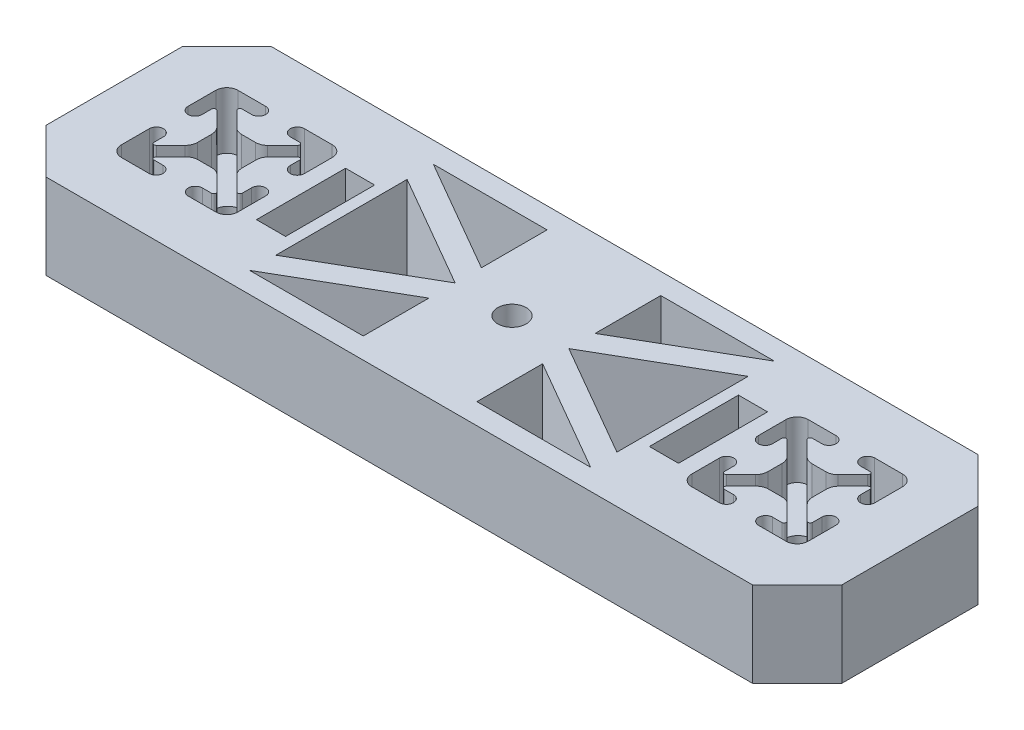
from build123d import *

# Parameters (mm, degrees)
SKETCH1_W               = 177.8
SKETCH1_H               = 50.4000008
BOSS_EXTRUDE1_DEPTH     = 6.35
SKETCH2_W               = 177.8
SKETCH2_H               = 50.4000008
BOSS_EXTRUDE2_DEPTH     = 12.7
SKETCH3_R               = 3.175
CUT_EXTRUDE1_DEPTH      = 186.784559586
CUT_EXTRUDE2_DEPTH      = 186.784559586
CHAMFER1_SIZE           = 10
SKETCH5_W               = 6.5
SKETCH5_H               = 19.9
CUT_EXTRUDE3_DEPTH      = 10.2
SKETCH6_W               = 6.5
SKETCH6_H               = 4.572
CUT_EXTRUDE4_DEPTH      = 186.086574555
CUT_EXTRUDE5_DEPTH      = 186.784559586
CUT_EXTRUDE5_DEPTH_BACK = 186.784559586
SKETCH7_R               = 2.921
CUT_EXTRUDE6_DEPTH      = 186.241167349
CUT_EXTRUDE6_DEPTH_BACK = 186.241167349
SKETCH8_R               = 2.921


with BuildPart() as part:
    # Sketch1 → Boss-Extrude1 (new body)
    with BuildSketch(Plane(origin=(0, 0, 0), x_dir=(1, 0, 0), z_dir=(0, 1, 0))):
        with Locations((88.9, 25.2000004)):
            Rectangle(SKETCH1_W, SKETCH1_H)
    extrude(amount=BOSS_EXTRUDE1_DEPTH)

    # Sketch2 → Boss-Extrude2 (add)
    with BuildSketch(Plane(origin=(0, 6.35, 0), x_dir=(1, 0, 0), z_dir=(0, 1, 0))):
        with Locations((88.9, 25.2000004)):
            Rectangle(SKETCH2_W, SKETCH2_H)
        with BuildLine():
            Line((38.207602115, 29.52001185), (38.207602115, 35.7371571))
            ThreePointArc((38.207602115, 35.7371571), (37.48390875, 37.484307436), (35.736758415, 38.2080008))
            Line((35.736758415, 38.2080008), (29.519613165, 38.2080008))
            ThreePointArc((29.519613165, 38.2080008), (27.941613165, 36.6300008), (29.519613165, 35.0520008))
            Line((29.519613165, 35.0520008), (31.618952135, 35.0520008))
            ThreePointArc((31.618952135, 35.0520008), (32.082805957, 34.741944038), (31.973665066, 34.194784253))
            Line((31.973665066, 34.194784253), (28.637609194, 30.863479703))
            ThreePointArc((28.637609194, 30.863479703), (27.774459736, 30.287408726), (26.756632806, 30.085138862))
            Line((26.756632806, 30.085138862), (23.642969309, 30.085138862))
            ThreePointArc((23.642969309, 30.085138862), (22.625142379, 30.287408726), (21.761992921, 30.863479703))
            Line((21.761992921, 30.863479703), (18.425937049, 34.194784253))
            ThreePointArc((18.425937049, 34.194784253), (18.316796158, 34.741944038), (18.78064998, 35.0520008))
            Line((18.78064998, 35.0520008), (20.87998895, 35.0520008))
            ThreePointArc((20.87998895, 35.0520008), (22.45798895, 36.6300008), (20.87998895, 38.2080008))
            Line((20.87998895, 38.2080008), (14.6628437, 38.2080008))
            ThreePointArc((14.6628437, 38.2080008), (12.915693364, 37.484307436), (12.192, 35.7371571))
            Line((12.192, 35.7371571), (12.192, 29.52001185))
            ThreePointArc((12.192, 29.52001185), (13.77, 27.94201185), (15.348, 29.52001185))
            Line((15.348, 29.52001185), (15.348, 31.596493464))
            ThreePointArc((15.348, 31.596493464), (15.657726258, 32.060210386), (16.204710632, 31.95171231))
            Line((16.204710632, 31.95171231), (19.406929995, 28.754053655))
            ThreePointArc((19.406929995, 28.754053655), (20.019806023, 27.837880259), (20.235040084, 26.756832148))
            Line((20.235040084, 26.756832148), (20.235040084, 23.643168652))
            ThreePointArc((20.235040084, 23.643168652), (20.019806023, 22.562120541), (19.406929995, 21.645947145))
            Line((19.406929995, 21.645947145), (16.204710632, 18.44828849))
            ThreePointArc((16.204710632, 18.44828849), (15.657726258, 18.339790414), (15.348, 18.803507336))
            Line((15.348, 18.803507336), (15.348, 20.87998895))
            ThreePointArc((15.348, 20.87998895), (13.77, 22.45798895), (12.192, 20.87998895))
            Line((12.192, 20.87998895), (12.192, 14.6628437))
            ThreePointArc((12.192, 14.6628437), (12.915693364, 12.915693364), (14.6628437, 12.192))
            Line((14.6628437, 12.192), (20.812064149, 12.192))
            ThreePointArc((20.812064149, 12.192), (22.390064149, 13.77), (20.812064149, 15.348))
            Line((20.812064149, 15.348), (18.78064998, 15.348))
            ThreePointArc((18.78064998, 15.348), (18.316796158, 15.658056762), (18.425937049, 16.205216547))
            Line((18.425937049, 16.205216547), (21.761992921, 19.536521097))
            ThreePointArc((21.761992921, 19.536521097), (22.625142379, 20.112592074), (23.642969309, 20.314861938))
            Line((23.642969309, 20.314861938), (26.756632806, 20.314861938))
            ThreePointArc((26.756632806, 20.314861938), (27.774459736, 20.112592074), (28.637609194, 19.536521097))
            Line((28.637609194, 19.536521097), (31.973665066, 16.205216547))
            ThreePointArc((31.973665066, 16.205216547), (32.082805957, 15.658056762), (31.618952135, 15.348))
            Line((31.618952135, 15.348), (29.587537966, 15.348))
            ThreePointArc((29.587537966, 15.348), (28.009537966, 13.77), (29.587537966, 12.192))
            Line((29.587537966, 12.192), (35.736758415, 12.192))
            ThreePointArc((35.736758415, 12.192), (37.48390875, 12.915693364), (38.207602115, 14.6628437))
            Line((38.207602115, 14.6628437), (38.207602115, 20.87998895))
            ThreePointArc((38.207602115, 20.87998895), (36.629602115, 22.45798895), (35.051602115, 20.87998895))
            Line((35.051602115, 20.87998895), (35.051602115, 18.803507336))
            ThreePointArc((35.051602115, 18.803507336), (34.741875857, 18.339790414), (34.194891482, 18.44828849))
            Line((34.194891482, 18.44828849), (30.99267212, 21.645947145))
            ThreePointArc((30.99267212, 21.645947145), (30.379796092, 22.562120541), (30.16456203, 23.643168652))
            Line((30.16456203, 23.643168652), (30.16456203, 26.756832148))
            ThreePointArc((30.16456203, 26.756832148), (30.379796092, 27.837880259), (30.99267212, 28.754053655))
            Line((30.99267212, 28.754053655), (34.194891482, 31.95171231))
            ThreePointArc((34.194891482, 31.95171231), (34.741875857, 32.060210386), (35.051602115, 31.596493464))
            Line((35.051602115, 31.596493464), (35.051602115, 29.52001185))
            ThreePointArc((35.051602115, 29.52001185), (36.629602115, 27.94201185), (38.207602115, 29.52001185))
        make_face(mode=Mode.SUBTRACT)
        with BuildLine():
            Line((142.748397885, 31.596493464), (142.748397885, 29.52001185))
            ThreePointArc((142.748397885, 29.52001185), (141.170397885, 27.94201185), (139.592397885, 29.52001185))
            Line((139.592397885, 29.52001185), (139.592397885, 35.7371571))
            ThreePointArc((139.592397885, 35.7371571), (140.31609125, 37.484307436), (142.063241585, 38.2080008))
            Line((142.063241585, 38.2080008), (148.280386835, 38.2080008))
            ThreePointArc((148.280386835, 38.2080008), (149.858386835, 36.6300008), (148.280386835, 35.0520008))
            Line((148.280386835, 35.0520008), (146.181047865, 35.0520008))
            ThreePointArc((146.181047865, 35.0520008), (145.717194043, 34.741944038), (145.826334934, 34.194784253))
            Line((145.826334934, 34.194784253), (149.162390806, 30.863479703))
            ThreePointArc((149.162390806, 30.863479703), (150.025540264, 30.287408726), (151.043367194, 30.085138862))
            Line((151.043367194, 30.085138862), (154.157030691, 30.085138862))
            ThreePointArc((154.157030691, 30.085138862), (155.174857621, 30.287408726), (156.038007079, 30.863479703))
            Line((156.038007079, 30.863479703), (159.374062951, 34.194784253))
            ThreePointArc((159.374062951, 34.194784253), (159.483203842, 34.741944038), (159.01935002, 35.0520008))
            Line((159.01935002, 35.0520008), (156.92001105, 35.0520008))
            ThreePointArc((156.92001105, 35.0520008), (155.34201105, 36.6300008), (156.92001105, 38.2080008))
            Line((156.92001105, 38.2080008), (163.1371563, 38.2080008))
            ThreePointArc((163.1371563, 38.2080008), (164.884306636, 37.484307436), (165.608, 35.7371571))
            Line((165.608, 35.7371571), (165.608, 29.52001185))
            ThreePointArc((165.608, 29.52001185), (164.03, 27.94201185), (162.452, 29.52001185))
            Line((162.452, 29.52001185), (162.452, 31.596493464))
            ThreePointArc((162.452, 31.596493464), (162.142273742, 32.060210386), (161.595289368, 31.95171231))
            Line((161.595289368, 31.95171231), (158.393070005, 28.754053655))
            ThreePointArc((158.393070005, 28.754053655), (157.780193977, 27.837880259), (157.564959916, 26.756832148))
            Line((157.564959916, 26.756832148), (157.564959916, 23.643168652))
            ThreePointArc((157.564959916, 23.643168652), (157.780193977, 22.562120541), (158.393070005, 21.645947145))
            Line((158.393070005, 21.645947145), (161.595289368, 18.44828849))
            ThreePointArc((161.595289368, 18.44828849), (162.142273742, 18.339790414), (162.452, 18.803507336))
            Line((162.452, 18.803507336), (162.452, 20.87998895))
            ThreePointArc((162.452, 20.87998895), (164.03, 22.45798895), (165.608, 20.87998895))
            Line((165.608, 20.87998895), (165.608, 14.6628437))
            ThreePointArc((165.608, 14.6628437), (164.884306636, 12.915693364), (163.1371563, 12.192))
            Line((163.1371563, 12.192), (156.987935851, 12.192))
            ThreePointArc((156.987935851, 12.192), (155.409935851, 13.77), (156.987935851, 15.348))
            Line((156.987935851, 15.348), (159.01935002, 15.348))
            ThreePointArc((159.01935002, 15.348), (159.483203842, 15.658056762), (159.374062951, 16.205216547))
            Line((159.374062951, 16.205216547), (156.038007079, 19.536521097))
            ThreePointArc((156.038007079, 19.536521097), (155.174857621, 20.112592074), (154.157030691, 20.314861938))
            Line((154.157030691, 20.314861938), (151.043367194, 20.314861938))
            ThreePointArc((151.043367194, 20.314861938), (150.025540264, 20.112592074), (149.162390806, 19.536521097))
            Line((149.162390806, 19.536521097), (145.826334934, 16.205216547))
            ThreePointArc((145.826334934, 16.205216547), (145.717194043, 15.658056762), (146.181047865, 15.348))
            Line((146.181047865, 15.348), (148.212462034, 15.348))
            ThreePointArc((148.212462034, 15.348), (149.790462034, 13.77), (148.212462034, 12.192))
            Line((148.212462034, 12.192), (142.063241585, 12.192))
            ThreePointArc((142.063241585, 12.192), (140.31609125, 12.915693364), (139.592397885, 14.6628437))
            Line((139.592397885, 14.6628437), (139.592397885, 20.87998895))
            ThreePointArc((139.592397885, 20.87998895), (141.170397885, 22.45798895), (142.748397885, 20.87998895))
            Line((142.748397885, 20.87998895), (142.748397885, 18.803507336))
            ThreePointArc((142.748397885, 18.803507336), (143.058124143, 18.339790414), (143.605108518, 18.44828849))
            Line((143.605108518, 18.44828849), (146.80732788, 21.645947145))
            ThreePointArc((146.80732788, 21.645947145), (147.420203908, 22.562120541), (147.63543797, 23.643168652))
            Line((147.63543797, 23.643168652), (147.63543797, 26.756832148))
            ThreePointArc((147.63543797, 26.756832148), (147.420203908, 27.837880259), (146.80732788, 28.754053655))
            Line((146.80732788, 28.754053655), (143.605108518, 31.95171231))
            ThreePointArc((143.605108518, 31.95171231), (143.058124143, 32.060210386), (142.748397885, 31.596493464))
        make_face(mode=Mode.SUBTRACT)
    extrude(amount=BOSS_EXTRUDE2_DEPTH)

    # Sketch3 → Cut-Extrude1 (cut, through all)
    with BuildSketch(Plane(origin=(0, 19.05, 0), x_dir=(1, 0, 0), z_dir=(0, 1, 0))):
        with Locations((88.9, 25.2000004)):
            Circle(SKETCH3_R)
    extrude(amount=-CUT_EXTRUDE1_DEPTH, mode=Mode.SUBTRACT)

    # Sketch4 → Cut-Extrude2 (cut, through all)
    with BuildSketch(Plane(origin=(0, 19.05, 0), x_dir=(1, 0, 0), z_dir=(0, 1, 0))):
        Polygon((50.8, 45.730575972), (76.2, 45.730575972), (76.2, 31.065879135), align=None)
        Polygon((76.2, 19.334121665), (76.2, 4.669424828), (50.8, 4.669424828), align=None)
        Polygon((50.8, 39.864697237), (50.8, 10.535303563), (76.2, 25.2000004), align=None)
        Polygon((101.6, 25.2000004), (127, 39.864697237), (127, 10.535303563), align=None)
        Polygon((127, 4.669424828), (101.6, 19.334121665), (101.6, 4.669424828), align=None)
        Polygon((101.6, 31.065879135), (127, 45.730575972), (101.6, 45.730575972), align=None)
    extrude(amount=-CUT_EXTRUDE2_DEPTH, mode=Mode.SUBTRACT)

    # Chamfer1
    chamfer1_edges = [part.edges().sort_by_distance(p)[0] for p in [
        (177.8, 9.525, -50.4000008),
        (177.8, 9.525, 0),
        (0, 9.525, 0),
        (0, 9.525, -50.4000008),
    ]]
    chamfer(chamfer1_edges, length=CHAMFER1_SIZE)

    # Sketch5 → Cut-Extrude3 (cut)
    with BuildSketch(Plane(origin=(0, 19.05, 0), x_dir=(1, 0, 0), z_dir=(0, 1, 0))):
        with Locations((45.013602115, 25.2000004)):
            Rectangle(SKETCH5_W, SKETCH5_H)
    cut_extrude3 = extrude(amount=-CUT_EXTRUDE3_DEPTH, mode=Mode.SUBTRACT)

    # Sketch6 → Cut-Extrude4 (cut, through all)
    with BuildSketch(Plane(origin=(0, 8.85, 0), x_dir=(1, 0, 0), z_dir=(0, 1, 0))):
        with Locations((45.013602115, 32.8640004)):
            Rectangle(SKETCH6_W, SKETCH6_H)
        with Locations((45.013602115, 25.2000004)):
            Rectangle(SKETCH6_W, SKETCH6_H)
        with Locations((45.013602115, 17.5360004)):
            Rectangle(SKETCH6_W, SKETCH6_H)
    cut_extrude4 = extrude(amount=-CUT_EXTRUDE4_DEPTH, mode=Mode.SUBTRACT)

    # Mirror1: Cut-Extrude3, Cut-Extrude4 across plane
    add(cut_extrude3.mirror(Plane.ZY.offset(-88.9)), mode=Mode.SUBTRACT)
    add(cut_extrude4.mirror(Plane.ZY.offset(-88.9)), mode=Mode.SUBTRACT)

    # Sketch7 → Cut-Extrude5 (cut, two sides: drawn at the far end of the back side and taken through both)
    with BuildSketch(Plane(origin=(0, 19.05, 0), x_dir=(1, 0, 0), z_dir=(0, 1, 0)).offset(-CUT_EXTRUDE5_DEPTH_BACK)):
        with Locations((25.33856203, 25.259138862)):
            Circle(SKETCH7_R)
    extrude(amount=CUT_EXTRUDE5_DEPTH + CUT_EXTRUDE5_DEPTH_BACK, mode=Mode.SUBTRACT)

    # Sketch8 → Cut-Extrude6 (cut, two sides: drawn at the far end of the back side and taken through both)
    with BuildSketch(Plane(origin=(0, 6.35, 0), x_dir=(1, 0, 0), z_dir=(0, 1, 0)).offset(-CUT_EXTRUDE6_DEPTH_BACK)):
        with Locations((152.738959916, 25.259138862)):
            Circle(SKETCH8_R)
    extrude(amount=CUT_EXTRUDE6_DEPTH + CUT_EXTRUDE6_DEPTH_BACK, mode=Mode.SUBTRACT)


solid = part.part
